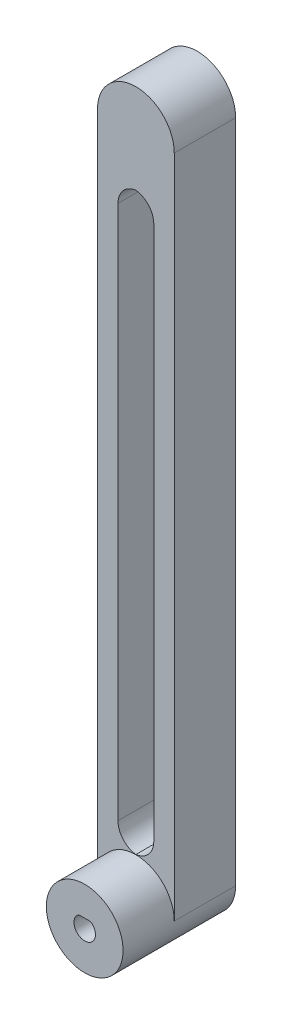
from build123d import *

# Parameters (mm, degrees)
BOSS_EXTRUDE1_DEPTH = 12
SKETCH2_R           = 3.1
BOSS_EXTRUDE2_DEPTH = 15
CUT_EXTRUDE1_START  = -50
CUT_EXTRUDE1_DEPTH  = 50
CUT_EXTRUDE2_START  = -15
CUT_EXTRUDE2_DEPTH  = 15
SKETCH5_W           = 7
SKETCH5_H           = 112.5
CUT_EXTRUDE3_DEPTH  = 12
SKETCH6_R           = 5.15
CUT_EXTRUDE4_DEPTH  = 2
FILLET1_R           = 4
BOSS_EXTRUDE3_DEPTH = 10
SKETCH9_R           = 2.1
CUT_EXTRUDE5_DEPTH  = 7
BOSS_EXTRUDE4_DEPTH = 7


with BuildPart() as part:
    # Sketch1 → Boss-Extrude1 (new body)
    with BuildSketch(Plane.XY):
        with BuildLine():
            Line((-5.64516129, 102.580645161), (-5.64516129, -27.419354839))
            ThreePointArc((-5.64516129, -27.419354839), (1.85483871, -34.919354839), (9.35483871, -27.419354839))
            Line((9.35483871, -27.419354839), (9.35483871, 102.580645161))
            ThreePointArc((9.35483871, 102.580645161), (1.85483871, 110.080645161), (-5.64516129, 102.580645161))
        make_face()
    extrude(amount=BOSS_EXTRUDE1_DEPTH)

    # Sketch2 → Boss-Extrude2 (add)
    with BuildSketch(Plane.XY.offset(12)):
        with Locations(Location((1.85483871, -27.419354839, 0), (0, 0, 180))):
            Circle(SKETCH2_R)
    extrude(amount=BOSS_EXTRUDE2_DEPTH)

    # Sketch3 → Cut-Extrude1 (cut)
    with BuildSketch(Plane.XY.offset(27).offset(CUT_EXTRUDE1_START)):
        with BuildLine():
            Line((0.166644408, -24.819354839), (3.543033011, -24.819354839))
            ThreePointArc((3.543033011, -24.819354839), (1.85483871, -30.519354839), (0.166644408, -24.819354839))
        make_face()
    extrude(amount=CUT_EXTRUDE1_DEPTH, mode=Mode.SUBTRACT)

    # Sketch4 → Cut-Extrude2 (cut)
    with BuildSketch(Plane.XY.offset(27).offset(CUT_EXTRUDE2_START)):
        with BuildLine():
            Line((0.166644408, -24.819354839), (3.543033011, -24.819354839))
            ThreePointArc((3.543033011, -24.819354839), (1.85483871, -24.319354839), (0.166644408, -24.819354839))
        make_face()
    extrude(amount=CUT_EXTRUDE2_DEPTH, mode=Mode.SUBTRACT)

    # Sketch5 → Cut-Extrude3 (cut)
    with BuildSketch(Plane.XY.offset(12)):
        with Locations((1.85483871, 36.330645161)):
            Rectangle(SKETCH5_W, SKETCH5_H)
    extrude(amount=-CUT_EXTRUDE3_DEPTH, mode=Mode.SUBTRACT)

    # Sketch6 → Cut-Extrude4 (cut)
    with BuildSketch(Plane.ZY.offset(5.64516129)):
        with Locations(Location((6, 78.768969581, 0), (0, 0, 270))):
            Circle(SKETCH6_R)
        with Locations(Location((6, 53.768969581, 0), (0, 0, 270))):
            Circle(SKETCH6_R)
        with Locations(Location((6, 28.768969581, 0), (0, 0, 270))):
            Circle(SKETCH6_R)
    extrude(amount=-CUT_EXTRUDE4_DEPTH, mode=Mode.SUBTRACT)

    # Fillet1
    # the kernel refuses this fillet: 4 mm, written as the material it adds along each edge
    with BuildSketch(Plane(origin=(-1.64516129, -19.919354839, 12), x_dir=(0, 1, 0), z_dir=(0, 0, -1)), Plane(origin=(5.35483871, -19.919354839, 12), x_dir=(-1, 0, 0), z_dir=(0, 0, -1)), Plane(origin=(5.35483871, 92.580645161, 12), x_dir=(0, -1, 0), z_dir=(0, 0, -1))) as fillet1_piece_1:
        with BuildLine():
            CenterArc((FILLET1_R, FILLET1_R), FILLET1_R, 180, 90)
            Line((0, FILLET1_R), (0, 0))
            Line((0, 0), (FILLET1_R, 0))
        make_face()
    extrude(amount=12)
    with BuildSketch(Plane(origin=(-1.64516129, 92.580645161, 12), x_dir=(0, -1, 0), z_dir=(0, 0, -1))) as fillet1_piece_2:
        with BuildLine():
            CenterArc((FILLET1_R, -FILLET1_R), FILLET1_R, 90, 90)
            Line((0, -FILLET1_R), (0, 0))
            Line((0, 0), (FILLET1_R, 0))
        make_face()
    extrude(amount=12)

    # Sketch7 → Boss-Extrude3 (add)
    with BuildSketch(Plane.XY.offset(12)):
        with BuildLine():
            ThreePointArc((-5.64516129, -27.419354839), (1.85483871, -34.919354839), (9.35483871, -27.419354839))
            ThreePointArc((9.35483871, -27.419354839), (1.85483871, -19.919354839), (-5.64516129, -27.419354839))
        make_face()
    extrude(amount=BOSS_EXTRUDE3_DEPTH)

    # Sketch9 → Cut-Extrude5 (cut)
    with BuildSketch(Plane.XY.offset(22)):
        with Locations((1.85483871, -27.419354839)):
            Circle(SKETCH9_R)
    extrude(amount=-CUT_EXTRUDE5_DEPTH, mode=Mode.SUBTRACT)

    # Sketch10 → Boss-Extrude4 (add)
    with BuildSketch(Plane.XY.offset(22)):
        with BuildLine():
            Line((0.694020033, -25.669354839), (3.015657386, -25.669354839))
            ThreePointArc((3.015657386, -25.669354839), (1.85483871, -25.319354839), (0.694020033, -25.669354839))
        make_face()
    extrude(amount=-BOSS_EXTRUDE4_DEPTH)


solid = part.part
